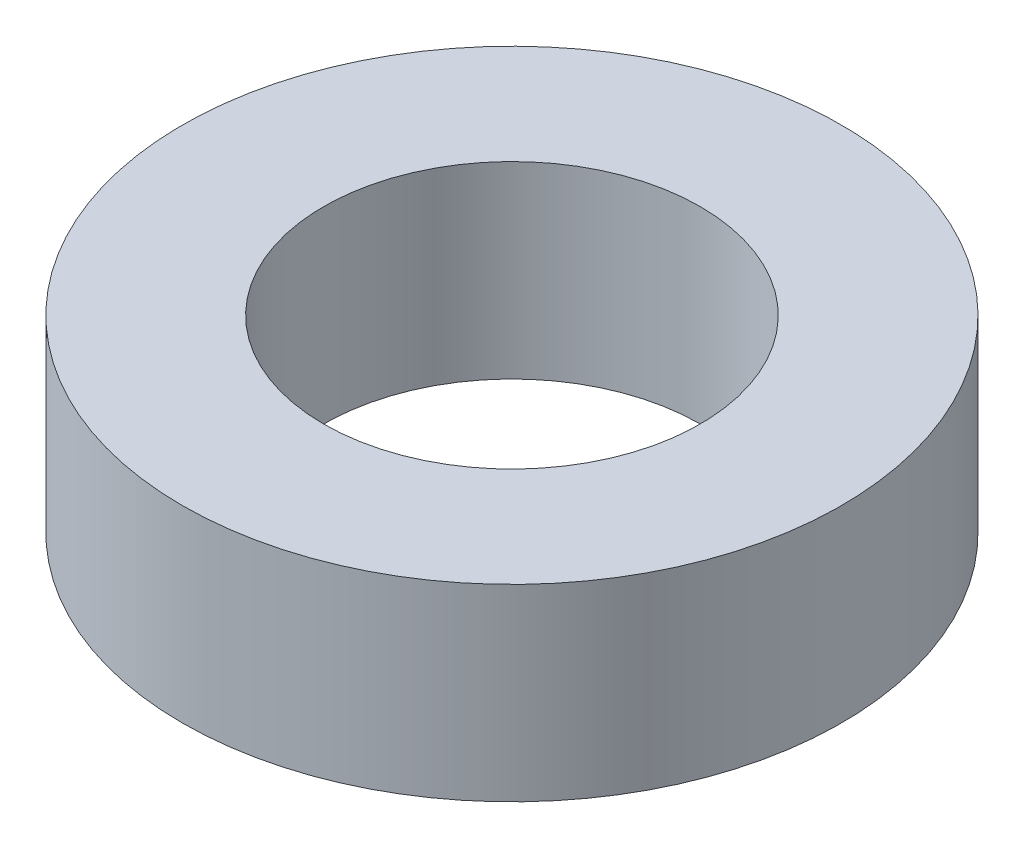
from build123d import *

# Parameters (mm, degrees)
SKETCH1_R           = 17.5
BOSS_EXTRUDE1_DEPTH = 10
SKETCH2_R           = 10
CUT_EXTRUDE1_DEPTH  = 27.69269563


with BuildPart() as part:
    # Sketch1 → Boss-Extrude1 (new body)
    with BuildSketch(Plane(origin=(0, 0, 0), x_dir=(1, 0, 0), z_dir=(0, 1, 0))):
        Circle(SKETCH1_R)
    extrude(amount=BOSS_EXTRUDE1_DEPTH)

    # Sketch2 → Cut-Extrude1 (cut, through all)
    with BuildSketch(Plane(origin=(0, 0, 0), x_dir=(1, 0, 0), z_dir=(0, 1, 0))):
        Circle(SKETCH2_R)
    extrude(amount=CUT_EXTRUDE1_DEPTH, mode=Mode.SUBTRACT)


solid = part.part
